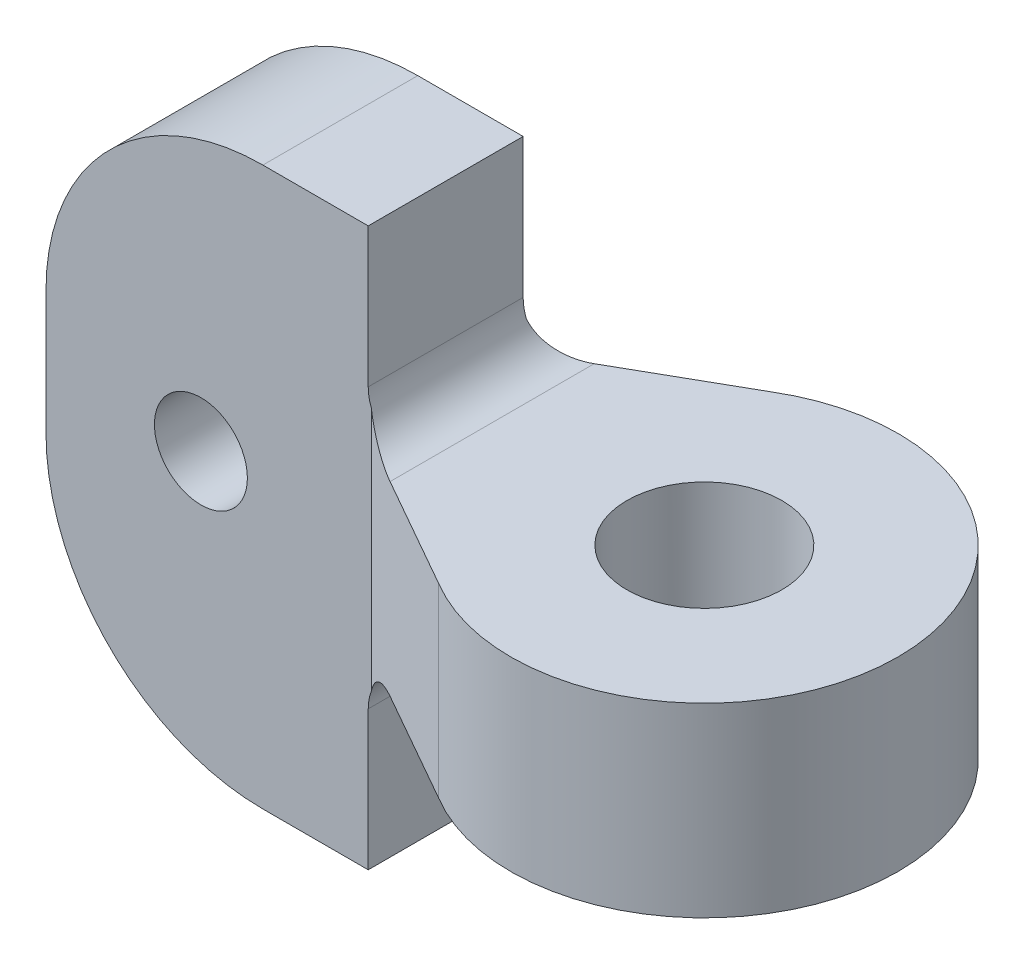
from build123d import *
from build123d.topology import SkipClean

# Parameters (mm, degrees)
CROQUIS1_R              = 1.5
SALIENTE_EXTRUIR1_DEPTH = 15
CROQUIS2_R              = 2.5
CORTAR_EXTRUIR1_DEPTH   = 20
CORTAR_EXTRUIR2_START   = -22
CORTAR_EXTRUIR2_DEPTH   = 22
CROQUIS4_W              = 2.1
CROQUIS4_H              = 6
CORTAR_EXTRUIR4_DEPTH   = 10
REDONDEO1_R             = 1.5


with BuildPart() as part:
    # Croquis1 → Saliente-Extruir1 (new body)
    with BuildSketch(Plane.XY):
        with BuildLine():
            Line((11.25, 17.1), (11.25, 11.1))
            Line((11.25, 11.1), (23.75, 11.1))
            Line((23.75, 11.1), (23.75, 5.1))
            Line((23.75, 5.1), (11.25, 5.1))
            Line((11.25, 5.1), (11.25, -0.9))
            Line((11.25, -0.9), (5.75, -0.9))
            ThreePointArc((5.75, -0.9), (0.800252532, 1.150252532), (-1.25, 6.1))
            Line((-1.25, 6.1), (-1.25, 10.1))
            ThreePointArc((-1.25, 10.1), (0.800252532, 15.049747468), (5.75, 17.1))
            Line((5.75, 17.1), (11.25, 17.1))
        make_face()
        with Locations((3.75, 8.1)):
            Circle(CROQUIS1_R, mode=Mode.SUBTRACT)
    extrude(amount=SALIENTE_EXTRUIR1_DEPTH)

    # Croquis2 → Cortar-Extruir1 (cut)
    with BuildSketch(Plane(origin=(0, 0, 0), x_dir=(1, 0, 0), z_dir=(0, 1, 0))):
        with Locations(Location((17.5, -7.5, 0), (0, 0, 90))):
            Circle(CROQUIS2_R)
        with BuildLine():
            Line((17.5, -1.25), (11.25, 0))
            Line((11.25, 0), (11.126279301, 1.868603497))
            Line((11.126279301, 1.868603497), (29.663453957, 1.868603497))
            Line((29.663453957, 1.868603497), (29.663453957, -17.961269996))
            Line((29.663453957, -17.961269996), (11.25, -17.961269996))
            Line((11.25, -17.961269996), (11.25, -15))
            Line((11.25, -15), (17.5, -13.75))
            ThreePointArc((17.5, -13.75), (23.75, -7.5), (17.5, -1.25))
        make_face()
    extrude(amount=CORTAR_EXTRUIR1_DEPTH, mode=Mode.SUBTRACT)

    # Croquis3 → Cortar-Extruir2 (cut)
    with SkipClean():  # the faces are left unmerged after this step: merging them gives an invalid solid
        with BuildSketch(Plane(origin=(0, 17.1, 0), x_dir=(1, 0, 0), z_dir=(0, 1, 0)).offset(CORTAR_EXTRUIR2_START)):
            with BuildLine():
                Line((-4.130088798, -10), (9.25, -10))
                Line((9.25, -10), (14.284401529, -12.859330786))
                ThreePointArc((14.284401529, -12.859330786), (15.831665113, -13.523218301), (17.5, -13.75))
                Line((17.5, -13.75), (17.5, -15.581395259))
                Line((17.5, -15.581395259), (-4.130088798, -15.581395259))
                Line((-4.130088798, -15.581395259), (-4.130088798, -10))
            make_face()
            with BuildLine():
                Line((-3.464792336, -5), (9.25, -5))
                Line((9.25, -5), (14.284401529, -2.140669214))
                ThreePointArc((14.284401529, -2.140669214), (15.831665113, -1.476781699), (17.5, -1.25))
                Line((17.5, -1.25), (17.5, 1.677177667))
                Line((17.5, 1.677177667), (-3.464792336, 1.677177667))
                Line((-3.464792336, 1.677177667), (-3.464792336, -5))
            make_face()
        extrude(amount=CORTAR_EXTRUIR2_DEPTH, mode=Mode.SUBTRACT)

    # Croquis4 → Cortar-Extruir4 (cut, symmetric)
    with SkipClean():  # the faces are left unmerged after this step: merging them gives an invalid solid
        with BuildSketch(Plane.XY.offset(10)):
            with Locations((10.2, 14.1)):
                Rectangle(CROQUIS4_W, CROQUIS4_H)
            with Locations((10.2, 2.1)):
                Rectangle(CROQUIS4_W, CROQUIS4_H)
        extrude(amount=CORTAR_EXTRUIR4_DEPTH, both=True, mode=Mode.SUBTRACT)

    # Redondeo1
    # the kernel refuses this fillet: 1.5 mm, written as the material it adds along each edge
    with BuildSketch(Plane(origin=(9.15, 5.1, 1.25), x_dir=(0, -1, 0), z_dir=(0, 0, 1))) as redondeo1_piece_1_section:
        with BuildLine():
            CenterArc((REDONDEO1_R, REDONDEO1_R), REDONDEO1_R, 180, 90)
            Line((0, REDONDEO1_R), (0, 0))
            Line((0, 0), (REDONDEO1_R, 0))
        make_face()
    redondeo1_piece_1 = extrude(amount=8.75, mode=Mode.PRIVATE)
    redondeo1_piece_1 = split(redondeo1_piece_1, bisect_by=Plane(origin=(9.866987005, 4.973706672, 5), z_dir=(0, 0, -1)), keep=Keep.TOP, mode=Mode.PRIVATE)
    redondeo1_piece_1 = split(redondeo1_piece_1, bisect_by=Plane(origin=(9.791745369, 4.973706672, 4.692311151), z_dir=(0.49386255985599625, 0, 0.8695399772135164)), keep=Keep.TOP, mode=Mode.PRIVATE)
    add(redondeo1_piece_1)
    with BuildSketch(Plane(origin=(9.15, 5.1, 5), x_dir=(0, -1, 0), z_dir=(0, 0, 1))) as redondeo1_piece_2_section:
        with BuildLine():
            CenterArc((REDONDEO1_R, REDONDEO1_R), REDONDEO1_R, 180, 90)
            Line((0, REDONDEO1_R), (0, 0))
            Line((0, 0), (REDONDEO1_R, 0))
        make_face()
    redondeo1_piece_2 = extrude(amount=5, mode=Mode.PRIVATE)
    redondeo1_piece_2 = split(redondeo1_piece_2, bisect_by=Plane(origin=(9.170637547, 4.440228568, 5.045074574), z_dir=(-0.49386255985599625, 0, -0.8695399772135164)), keep=Keep.TOP, mode=Mode.PRIVATE)
    add(redondeo1_piece_2)
    with BuildSketch(Plane(origin=(9.15, 5.1, 5), x_dir=(0, -1, 0), z_dir=(0, 0, 1))) as redondeo1_piece_3_section:
        with BuildLine():
            CenterArc((REDONDEO1_R, REDONDEO1_R), REDONDEO1_R, 180, 90)
            Line((0, REDONDEO1_R), (0, 0))
            Line((0, 0), (REDONDEO1_R, 0))
        make_face()
    redondeo1_piece_3 = extrude(amount=5, mode=Mode.PRIVATE)
    redondeo1_piece_3 = split(redondeo1_piece_3, bisect_by=Plane(origin=(8.358711998, 4.761869179, 9.493785466), z_dir=(0.49386255985599636, 0, -0.8695399772135163)), keep=Keep.TOP, mode=Mode.PRIVATE)
    redondeo1_piece_3 = split(redondeo1_piece_3, bisect_by=Plane(origin=(8.358711998, 4.761869179, 5.506214534), z_dir=(0.49386255985599625, 0, 0.8695399772135164)), keep=Keep.TOP, mode=Mode.PRIVATE)
    add(redondeo1_piece_3)
    with BuildSketch(Plane(origin=(9.15, 5.1, 5), x_dir=(0, -1, 0), z_dir=(0, 0, 1))) as redondeo1_piece_4_section:
        with BuildLine():
            CenterArc((REDONDEO1_R, REDONDEO1_R), REDONDEO1_R, 180, 90)
            Line((0, REDONDEO1_R), (0, 0))
            Line((0, 0), (REDONDEO1_R, 0))
        make_face()
    redondeo1_piece_4 = extrude(amount=8.75, mode=Mode.PRIVATE)
    redondeo1_piece_4 = split(redondeo1_piece_4, bisect_by=Plane(origin=(9.866987005, 4.973706672, 10), z_dir=(0, 0, 1)), keep=Keep.TOP, mode=Mode.PRIVATE)
    redondeo1_piece_4 = split(redondeo1_piece_4, bisect_by=Plane(origin=(9.791745369, 4.973706672, 10.307688849), z_dir=(0.49386255985599636, 0, -0.8695399772135163)), keep=Keep.TOP, mode=Mode.PRIVATE)
    add(redondeo1_piece_4)
    with BuildSketch(Plane(origin=(9.15, 5.1, 5), x_dir=(0, -1, 0), z_dir=(0, 0, 1))) as redondeo1_piece_5_section:
        with BuildLine():
            CenterArc((REDONDEO1_R, REDONDEO1_R), REDONDEO1_R, 180, 90)
            Line((0, REDONDEO1_R), (0, 0))
            Line((0, 0), (REDONDEO1_R, 0))
        make_face()
    redondeo1_piece_5 = extrude(amount=5, mode=Mode.PRIVATE)
    redondeo1_piece_5 = split(redondeo1_piece_5, bisect_by=Plane(origin=(9.170637547, 4.440228568, 9.954925426), z_dir=(-0.49386255985599636, 0, 0.8695399772135163)), keep=Keep.TOP, mode=Mode.PRIVATE)
    add(redondeo1_piece_5)
    with BuildSketch(Plane(origin=(9.15, 11.1, 5), x_dir=(1, 0, 0), z_dir=(0, 0, 1))) as redondeo1_piece_6_section:
        with BuildLine():
            CenterArc((REDONDEO1_R, REDONDEO1_R), REDONDEO1_R, 180, 90)
            Line((0, REDONDEO1_R), (0, 0))
            Line((0, 0), (REDONDEO1_R, 0))
        make_face()
    redondeo1_piece_6 = extrude(amount=5, mode=Mode.PRIVATE)
    redondeo1_piece_6 = split(redondeo1_piece_6, bisect_by=Plane(origin=(9.17063755, 11.759771469, 5.045074573), z_dir=(-0.49386255985599625, 0, -0.8695399772135164)), keep=Keep.TOP, mode=Mode.PRIVATE)
    add(redondeo1_piece_6)
    with BuildSketch(Plane(origin=(9.15, 11.1, 1.25), x_dir=(1, 0, 0), z_dir=(0, 0, 1))) as redondeo1_piece_7_section:
        with BuildLine():
            CenterArc((REDONDEO1_R, REDONDEO1_R), REDONDEO1_R, 180, 90)
            Line((0, REDONDEO1_R), (0, 0))
            Line((0, 0), (REDONDEO1_R, 0))
        make_face()
    redondeo1_piece_7 = extrude(amount=8.75, mode=Mode.PRIVATE)
    redondeo1_piece_7 = split(redondeo1_piece_7, bisect_by=Plane(origin=(9.866987013, 11.226293308, 5), z_dir=(0, 0, -1)), keep=Keep.TOP, mode=Mode.PRIVATE)
    redondeo1_piece_7 = split(redondeo1_piece_7, bisect_by=Plane(origin=(9.791745378, 11.226293308, 4.692311146), z_dir=(0.49386255985599625, 0, 0.8695399772135164)), keep=Keep.TOP, mode=Mode.PRIVATE)
    add(redondeo1_piece_7)
    with BuildSketch(Plane(origin=(9.15, 11.1, 5), x_dir=(1, 0, 0), z_dir=(0, 0, 1))) as redondeo1_piece_8_section:
        with BuildLine():
            CenterArc((REDONDEO1_R, REDONDEO1_R), REDONDEO1_R, 180, 90)
            Line((0, REDONDEO1_R), (0, 0))
            Line((0, 0), (REDONDEO1_R, 0))
        make_face()
    redondeo1_piece_8 = extrude(amount=5, mode=Mode.PRIVATE)
    redondeo1_piece_8 = split(redondeo1_piece_8, bisect_by=Plane(origin=(8.358711999, 11.438130822, 5.506214534), z_dir=(0.49386255985599625, 0, 0.8695399772135164)), keep=Keep.TOP, mode=Mode.PRIVATE)
    redondeo1_piece_8 = split(redondeo1_piece_8, bisect_by=Plane(origin=(8.358711999, 11.438130822, 9.493785466), z_dir=(0.49386255985599636, 0, -0.8695399772135163)), keep=Keep.TOP, mode=Mode.PRIVATE)
    add(redondeo1_piece_8)
    with BuildSketch(Plane(origin=(9.15, 11.1, 5), x_dir=(1, 0, 0), z_dir=(0, 0, 1))) as redondeo1_piece_9_section:
        with BuildLine():
            CenterArc((REDONDEO1_R, REDONDEO1_R), REDONDEO1_R, 180, 90)
            Line((0, REDONDEO1_R), (0, 0))
            Line((0, 0), (REDONDEO1_R, 0))
        make_face()
    redondeo1_piece_9 = extrude(amount=5, mode=Mode.PRIVATE)
    redondeo1_piece_9 = split(redondeo1_piece_9, bisect_by=Plane(origin=(9.17063755, 11.759771469, 9.954925427), z_dir=(-0.49386255985599636, 0, 0.8695399772135163)), keep=Keep.TOP, mode=Mode.PRIVATE)
    add(redondeo1_piece_9)
    with BuildSketch(Plane(origin=(9.15, 11.1, 5), x_dir=(1, 0, 0), z_dir=(0, 0, 1))) as redondeo1_piece_10_section:
        with BuildLine():
            CenterArc((REDONDEO1_R, REDONDEO1_R), REDONDEO1_R, 180, 90)
            Line((0, REDONDEO1_R), (0, 0))
            Line((0, 0), (REDONDEO1_R, 0))
        make_face()
    redondeo1_piece_10 = extrude(amount=8.75, mode=Mode.PRIVATE)
    redondeo1_piece_10 = split(redondeo1_piece_10, bisect_by=Plane(origin=(9.866987013, 11.226293308, 10), z_dir=(0, 0, 1)), keep=Keep.TOP, mode=Mode.PRIVATE)
    redondeo1_piece_10 = split(redondeo1_piece_10, bisect_by=Plane(origin=(9.791745378, 11.226293308, 10.307688854), z_dir=(0.49386255985599636, 0, -0.8695399772135163)), keep=Keep.TOP, mode=Mode.PRIVATE)
    add(redondeo1_piece_10)


solid = part.part
